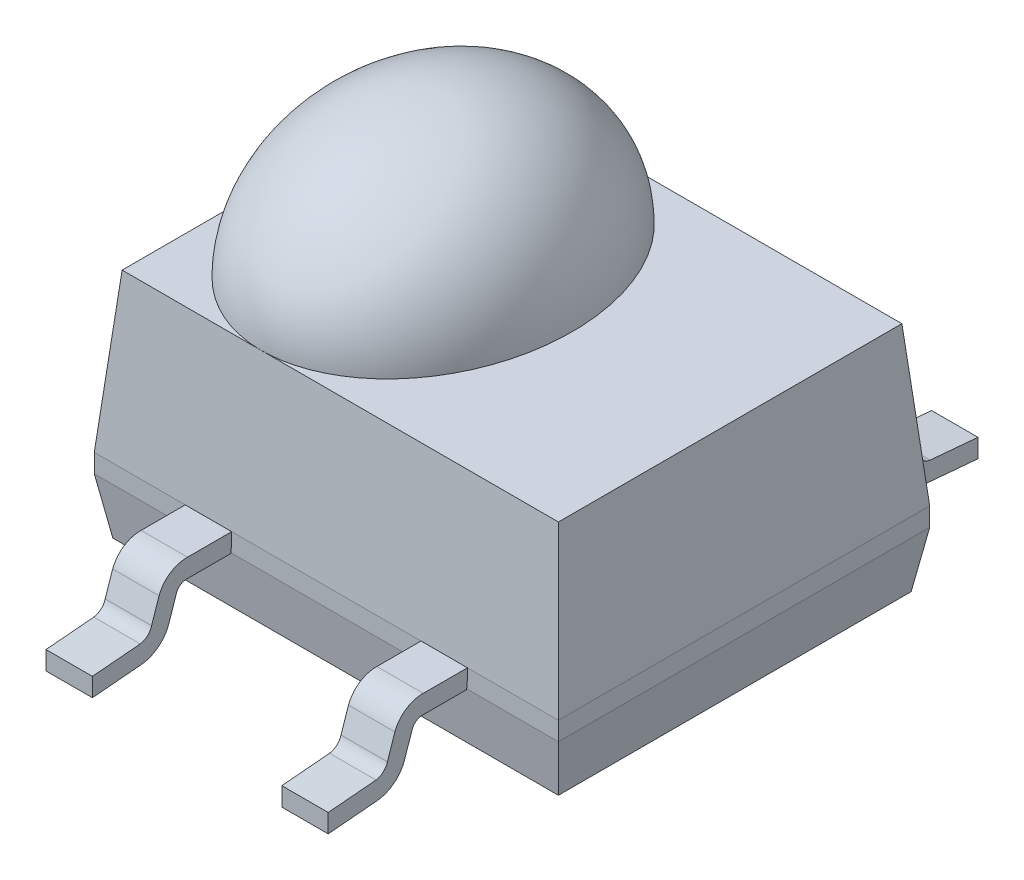
from build123d import *

# Parameters (mm, degrees)
SKETCH_1_W               = 5
SKETCH_1_H               = 4
EXTRUDE_1_DEPTH          = 0.2
LOFT_3_OUTLINE_W         = 4.8
LOFT_3_OUTLINE_H         = 3.8
LOFT_3_DEPTH             = 0.6
LOFT_3_DRAFT             = -9.4623222
SKETCH_9_W               = 0.5
SKETCH_9_H               = 0.2
PATTERN_LINEAR_1_COUNT   = 2
PATTERN_LINEAR_1_PITCH   = 2.54
MIRROR_1_COPY_1_SKETCH_W = 0.5
MIRROR_1_COPY_1_SKETCH_H = 0.2


# Read off the part's stored shape, not the designer's step: 放样3
with BuildPart() as part:
    # 草图1 → 凸台-拉伸1 (new body)
    with BuildSketch(Plane(origin=(0, 0, 0), x_dir=(1, 0, 0), z_dir=(0, 1, 0))):
        with Locations((2.5, 2)):
            Rectangle(SKETCH_1_W, SKETCH_1_H)
    extrude(amount=EXTRUDE_1_DEPTH)


with BuildPart() as loft_3_tool:
    # 放样3 outline → 放样3 (with draft: the straight prism first)
    with BuildSketch(Plane(origin=(0, -0.6, 0), x_dir=(1, 0, 0), z_dir=(0, 1, 0))):
        with Locations((2.5, 2)):
            Rectangle(LOFT_3_OUTLINE_W, LOFT_3_OUTLINE_H)
    extrude(amount=LOFT_3_DEPTH)
    # 放样3: the draft: its side faces are tilted about the plane it starts from
    loft_3_sides = [loft_3_tool.faces().sort_by_distance(p)[0] for p in [
        (2.5, -0.3, -3.9),
        (0.1, -0.3, -2),
        (2.5, -0.3, -0.1),
        (4.9, -0.3, -2),
    ]]
    draft(loft_3_sides, Plane(origin=(0, -0.6, 0), x_dir=(1, 0, 0), z_dir=(0, 1, 0)), LOFT_3_DRAFT)


with BuildPart() as part_1:
    add(part.part)

    # 放样3: add loft_3_tool
    add(loft_3_tool.part)

    # 草图4 → 放样5 section 0
    with BuildSketch(Plane(origin=(0, 0.2, 0), x_dir=(1, 0, 0), z_dir=(0, 1, 0))):
        with BuildLine():
            Line((0, 4), (5, 4))
            Line((5, 4), (5, 0))
            Line((5, 0), (0, 0))
            Line((0, 0), (0, 4))
        make_face()
    # 草图3 → 放样5 section 1
    with BuildSketch(Plane(origin=(0, 1.9, 0), x_dir=(1, 0, 0), z_dir=(0, 1, 0))):
        with BuildLine():
            Line((0.15, 3.85), (4.85, 3.85))
            Line((4.85, 3.85), (4.85, 0.15))
            Line((4.85, 0.15), (0.15, 0.15))
            Line((0.15, 0.15), (0.15, 3.85))
        make_face()
    loft()

    # 草图6 → 旋转1 (revolve)
    with BuildSketch(Plane(origin=(0, 1.9, 0), x_dir=(1, 0, 0), z_dir=(0, 1, 0))):
        with BuildLine():
            Line((1.65, 3.85), (1.65, 0.15))
            add(Edge.make_bspline(
                [(1.65, 3.85), (0.15, 3.85), (0.15, 2), (0.15, 0.15), (1.65, 0.15)],
                knots=[0, 0, 0, 1.570796327, 1.570796327, 3.141592654, 3.141592654, 3.141592654], degree=2, weights=[1, 0.707106781, 1, 0.707106781, 1]))
        make_face()
    revolve(axis=Axis((1.65, 1.9, 0.373474455), (0, 0, -1)))

    # 扫描2: sweep along a path in 草图7
    with BuildLine(Plane(origin=(3.77, 0, 0), x_dir=(0, 0, -1), z_dir=(1, 0, 0))) as sweep_2_path:
        Line((0, 0.099936428), (-0.484226547, 0.099936428))
        ThreePointArc((-0.484226547, 0.099936428), (-0.610923653, 0.059163591), (-0.690061218, -0.047849619))
        Line((-0.690061218, -0.047849619), (-0.770446454, -0.286097268))
        ThreePointArc((-0.770446454, -0.286097268), (-0.852673785, -0.402517912), (-0.98520599, -0.45496136))
        Line((-0.98520599, -0.45496136), (-1.5, -0.5))
    # 草图9 → 扫描2 (sweep)
    with BuildSketch(Plane.XY.offset(1.5)):
        with Locations((3.77, -0.5)):
            Rectangle(SKETCH_9_W, SKETCH_9_H)
    sweep_2 = sweep(path=sweep_2_path.line)

    # 阵列(线性)1: 扫描2 ×2
    with Locations(*[(-i * PATTERN_LINEAR_1_PITCH, 0, 0) for i in range(1, PATTERN_LINEAR_1_COUNT)]):
        add(sweep_2)

    # 镜向1: 扫描2 across plane
    add(sweep_2.mirror(Plane.XY.offset(-2)))

    # 镜向1 copy 1: sweep along a path in 镜向1 copy 1 path
    with BuildLine(Plane(origin=(1.23, 0, -4), x_dir=(0, 0, 1), z_dir=(1, 0, 0))) as mirror_1_copy_1_path:
        Line((0, -0.099936428), (-0.484226547, -0.099936428))
        ThreePointArc((-0.484226547, -0.099936428), (-0.610923653, -0.059163591), (-0.690061218, 0.047849619))
        Line((-0.690061218, 0.047849619), (-0.770446454, 0.286097268))
        ThreePointArc((-0.770446454, 0.286097268), (-0.852673785, 0.402517912), (-0.98520599, 0.45496136))
        Line((-0.98520599, 0.45496136), (-1.5, 0.5))
    # 镜向1 copy 1 sketch → 镜向1 copy 1 (sweep)
    with BuildSketch(Plane(origin=(-2.54, 0, -5.5), x_dir=(1, 0, 0), z_dir=(0, 0, -1))):
        with Locations((3.77, 0.5)):
            Rectangle(MIRROR_1_COPY_1_SKETCH_W, MIRROR_1_COPY_1_SKETCH_H)
    sweep(path=mirror_1_copy_1_path.line)


solid = part_1.part
